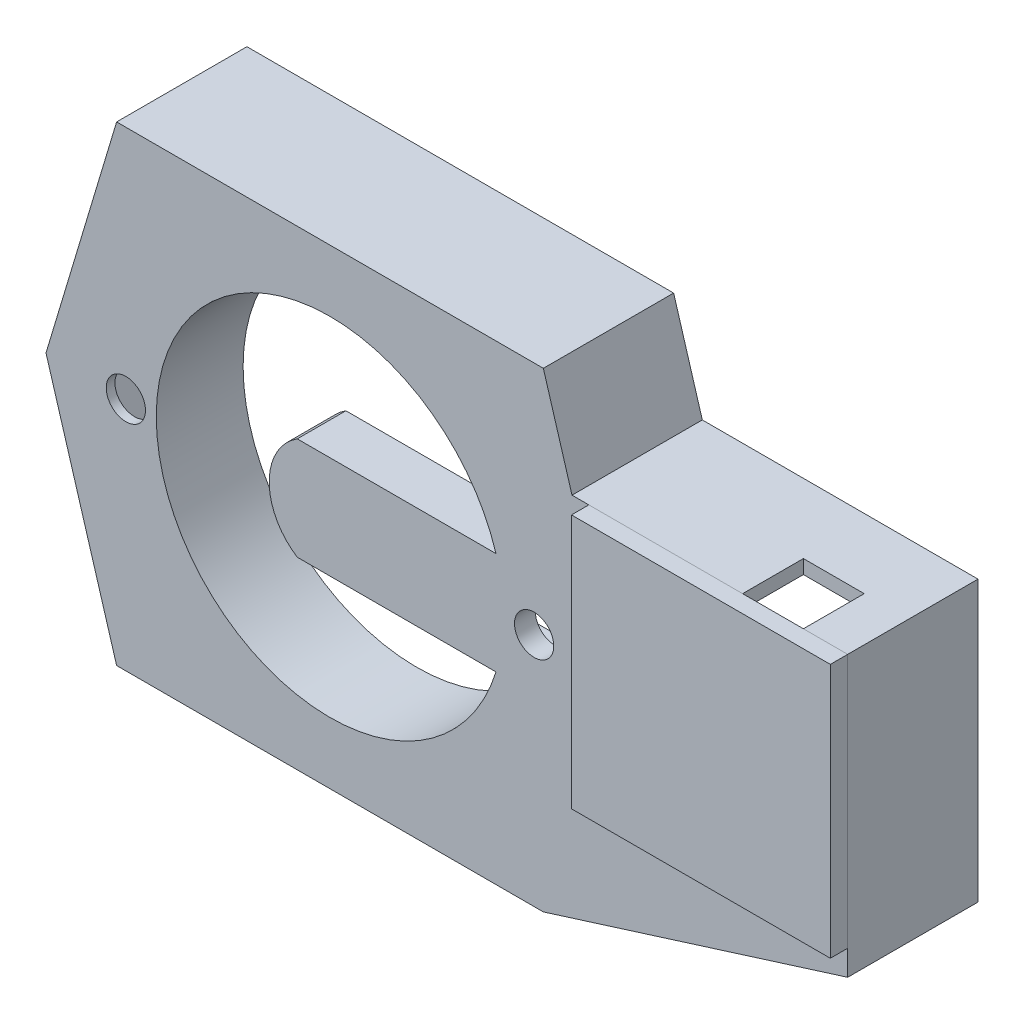
from build123d import *

# Parameters (mm, degrees)
BOSS_EXTRUDE1_DEPTH      = 10
BOSS_EXTRUDE1_DEPTH_BACK = 5
BOSS_EXTRUDE2_DEPTH      = 15
CUT_EXTRUDE1_DEPTH       = 68.168221653
BOSS_EXTRUDE3_DEPTH      = 4
SKETCH7_R                = 1.75
BOSS_EXTRUDE4_DEPTH      = 2.4
SKETCH8_R                = 3.5
BOSS_EXTRUDE5_DEPTH      = 1
CUT_EXTRUDE2_DEPTH       = 10
BOSS_EXTRUDE7_START      = 14
BOSS_EXTRUDE7_DEPTH      = 14
RIB9_START               = -9
RIB9_DEPTH               = 9
CUT_EXTRUDE3_DEPTH       = 5
SKETCH18_R               = 2.259673145
CUT_EXTRUDE4_DEPTH       = 68.168221653
SKETCH20_R               = 3.5
SKETCH20_W               = 8.6
SKETCH20_H               = 8.6
BOSS_EXTRUDE8_DEPTH      = 1
SKETCH21_W               = 7
SKETCH21_H               = 1.6
CUT_EXTRUDE5_DEPTH       = 7
BOSS_EXTRUDE9_DEPTH      = 1
BOSS_EXTRUDE10_DEPTH     = 14
BOSS_EXTRUDE11_DEPTH     = 2
SKETCH25_W               = 26.6
SKETCH25_H               = 26.1
BOSS_EXTRUDE12_DEPTH     = 1
BOSS_EXTRUDE13_DEPTH     = 4
CUT_EXTRUDE6_START       = -4
CUT_EXTRUDE6_DEPTH       = 4
BOSS_EXTRUDE14_DEPTH     = 1.6


# Read off the part's stored shape, not the designer's step: Rib9
with BuildPart() as part:
    # Sketch2 → Boss-Extrude1 (new, two sides: drawn at the far end of the back side and taken through both)
    with BuildSketch(Plane.XY.offset(12).offset(-BOSS_EXTRUDE1_DEPTH_BACK)):
        Polygon((-24.562464367, 27.1), (-32.692464367, 0), (-24.562464367, -27.1), (24.562464367, -27.1), (32.692464367, 0), (24.562464367, 27.1), align=None)
        Polygon((-23.372015325, 25.5), (-31.022015325, 0), (-23.372015325, -25.5), (23.372015325, -25.5), (31.022015325, 0), (23.372015325, 25.5), align=None, mode=Mode.SUBTRACT)
    extrude(amount=BOSS_EXTRUDE1_DEPTH + BOSS_EXTRUDE1_DEPTH_BACK)

    # Sketch3 → Boss-Extrude2 (add)
    with BuildSketch(Plane.XY.offset(22)):
        Polygon((29.5, 16.1), (59.6, 16.1), (59.6, -16.1), (29.5, -16.1), (27.862464367, -16.1), (28.342464367, -14.5), (29.5, -14.5), (58, -14.5), (58, 14.5), (29.5, 14.5), (28.342464367, 14.5), (27.862464367, 16.1), align=None)
    extrude(amount=-BOSS_EXTRUDE2_DEPTH)

    # Sketch4 → Cut-Extrude1 (cut, through all)
    with BuildSketch(Plane(origin=(0, 0, 7), x_dir=(-1, 0, 0), z_dir=(0, 0, -1))):
        Polygon((-26.672015325, 14.5), (-28.342464367, 14.5), (-32.692464367, 0), (-28.342464367, -14.5), (-26.672015325, -14.5), (-31.022015325, 0), align=None)
    extrude(amount=-CUT_EXTRUDE1_DEPTH, mode=Mode.SUBTRACT)

    # Sketch5 → Boss-Extrude3 (add)
    with BuildSketch(Plane.XY.offset(22)):
        Polygon((29, 4.3), (29, 14), (29, 14.5), (27.4, 14.5), (27.4, 14), (27.4, 5.9), (-4.6, 5.9), (-4.6, -5.9), (27.4, -5.9), (27.4, -14), (27.4, -14.5), (29, -14.5), (29, -14), (29, -4.3), (-3, -4.3), (-3, 4.3), align=None)
    extrude(amount=-BOSS_EXTRUDE3_DEPTH)

    # Sketch7 → Boss-Extrude4 (add)
    with BuildSketch(Plane.XY.offset(22)):
        Polygon((37, 12.1), (37, 14.5), (29, 14.5), (29, 4.3), (5.6, 4.3), (5.6, -4.3), (29, -4.3), (29, -14.5), (58, -14.5), (58, -11.6), (31.4, -11.6), (31.4, 12.1), align=None)
        with Locations((23.5, 0)):
            Circle(SKETCH7_R, mode=Mode.SUBTRACT)
    extrude(amount=-BOSS_EXTRUDE4_DEPTH)

    # Sketch8 → Boss-Extrude5 (add)
    with BuildSketch(Plane.XY.offset(22)):
        Polygon((27.4, -5.9), (27.4, -14.5), (26.672015325, -14.5), (23.372015325, -25.5), (-23.372015325, -25.5), (-31.022015325, 0), (-23.372015325, 25.5), (23.372015325, 25.5), (26.672015325, 14.5), (27.4, 14.5), (27.4, 5.9), (-4.6, 5.9), (-4.6, -5.9), align=None)
        with Locations((-18.25, 18.25)):
            Circle(SKETCH8_R, mode=Mode.SUBTRACT)
        with Locations((18.25, 18.25)):
            Circle(SKETCH8_R, mode=Mode.SUBTRACT)
        with Locations((18.25, -18.25)):
            Circle(SKETCH8_R, mode=Mode.SUBTRACT)
        with Locations((-18.25, -18.25)):
            Circle(SKETCH8_R, mode=Mode.SUBTRACT)
    extrude(amount=-BOSS_EXTRUDE5_DEPTH)

    # Sketch11 → Cut-Extrude2 (cut)
    with BuildSketch(Plane(origin=(0, 0, 21), x_dir=(-1, 0, 0), z_dir=(0, 0, -1))):
        with BuildLine():
            Line((4.6, -5.9), (-19.109945055, -5.9))
            ThreePointArc((-19.109945055, -5.9), (2.983378865, -19.776234489), (20, 0))
            ThreePointArc((20, 0), (2.983378865, 19.776234489), (-19.109945055, 5.9))
            Line((-19.109945055, 5.9), (4.6, 5.9))
            Line((4.6, 5.9), (4.6, -5.9))
        make_face()
    extrude(amount=-CUT_EXTRUDE2_DEPTH, mode=Mode.SUBTRACT)

    # Sketch12 → Boss-Extrude7 (add)
    with BuildSketch(Plane(origin=(0, 0, 21), x_dir=(-1, 0, 0), z_dir=(0, 0, -1)).offset(BOSS_EXTRUDE7_START)):
        with BuildLine():
            ThreePointArc((21.6, 0), (2.978452055, 21.393663159), (-20.778594755, 5.9))
            Line((-20.778594755, 5.9), (-19.109945055, 5.9))
            ThreePointArc((-19.109945055, 5.9), (20, 0), (-19.109945055, -5.9))
            Line((-19.109945055, -5.9), (-20.778594755, -5.9))
            ThreePointArc((-20.778594755, -5.9), (2.978452055, -21.393663159), (21.6, 0))
        make_face()
    extrude(amount=-BOSS_EXTRUDE7_DEPTH)

    # Rib9 outline → Rib9 (add)
    with BuildSketch(Plane(origin=(0, 0, 12), x_dir=(-1, 0, 0), z_dir=(0, 0, -1)).offset(RIB9_START)):
        with BuildLine():
            ThreePointArc((-0.8, 21.585180101), (0, 21.6), (0.8, 21.585180101))
            Line((0.8, 21.585180101), (0.8, 25.5))
            Line((0.8, 25.5), (-0.8, 25.5))
            Line((-0.8, 25.5), (-0.8, 21.585180101))
        make_face()
        with BuildLine():
            Line((26.205893326, 16.053739997), (18.293314313, 11.485410374))
            ThreePointArc((18.293314313, 11.485410374), (18.706148722, 10.8), (19.093314313, 10.099769728))
            Line((19.093314313, 10.099769728), (26.678322459, 14.478976222))
            Line((26.678322459, 14.478976222), (26.205893326, 16.053739997))
        make_face()
        with BuildLine():
            ThreePointArc((-19.093314313, 10.099769728), (-18.706148721, 10.8), (-18.293314313, 11.485410374))
            Line((-18.293314313, 11.485410374), (-26.205893326, 16.053739997))
            Line((-26.205893326, 16.053739997), (-26.672015325, 14.5))
            Line((-26.672015325, 14.5), (-26.71473671, 14.5))
            Line((-26.71473671, 14.5), (-19.093314313, 10.099769728))
        make_face()
        with BuildLine():
            Line((26.593085869, -14.763098188), (18.9565691, -10.354153175))
            ThreePointArc((18.9565691, -10.354153175), (18.560039094, -11.049205801), (18.138036207, -11.729093851))
            Line((18.138036207, -11.729093851), (26.120656737, -16.337861962))
            Line((26.120656737, -16.337861962), (26.593085869, -14.763098188))
        make_face()
        with BuildLine():
            Line((0.8, -25.5), (0.8, -21.585180101))
            ThreePointArc((0.8, -21.585180101), (0, -21.6), (-0.8, -21.585180101))
            Line((-0.8, -21.585180101), (-0.8, -25.5))
            Line((-0.8, -25.5), (0.8, -25.5))
        make_face()
        with BuildLine():
            Line((-26.291129916, -15.769618032), (-18.445244234, -11.239793821))
            ThreePointArc((-18.445244234, -11.239793821), (-18.848912462, -10.548862451), (-19.226711341, -9.843453205))
            Line((-19.226711341, -9.843453205), (-27.292086979, -14.5))
            Line((-27.292086979, -14.5), (-26.672015325, -14.5))
            Line((-26.672015325, -14.5), (-26.291129916, -15.769618032))
        make_face()
    extrude(amount=RIB9_DEPTH)

    # Sketch17 → Cut-Extrude3 (cut)
    with BuildSketch(Plane(origin=(0, 0, 7), x_dir=(-1, 0, 0), z_dir=(0, 0, -1))):
        with BuildLine():
            Line((-19.109945055, -5.9), (-20.778594755, -5.9))
            ThreePointArc((-20.778594755, -5.9), (21.6, 0), (-20.778594755, 5.9))
            Line((-20.778594755, 5.9), (-19.109945055, 5.9))
            ThreePointArc((-19.109945055, 5.9), (20, 0), (-19.109945055, -5.9))
        make_face()
    extrude(amount=-CUT_EXTRUDE3_DEPTH, mode=Mode.SUBTRACT)

    # Sketch18 → Cut-Extrude4 (cut, through all)
    with BuildSketch(Plane.XY.offset(22)):
        with Locations((-23.5, 0)):
            Circle(SKETCH18_R)
        with Locations((23.5, 0)):
            Circle(SKETCH18_R)
    extrude(amount=-CUT_EXTRUDE4_DEPTH, mode=Mode.SUBTRACT)

    # Sketch20 → Boss-Extrude8 (add)
    with BuildSketch(Plane.XY.offset(22)):
        with Locations((18.25, 18.25)):
            Circle(SKETCH20_R)
        with Locations((18.25, -18.25)):
            Circle(SKETCH20_R)
        with Locations((-18.25, -18.25)):
            Circle(SKETCH20_R)
        with Locations((-18.25, 18.25)):
            Circle(SKETCH20_R)
        with Locations((1.3, 0)):
            Rectangle(SKETCH20_W, SKETCH20_H)
    extrude(amount=-BOSS_EXTRUDE8_DEPTH)

    # Sketch21 → Cut-Extrude5 (cut)
    with BuildSketch(Plane.XY.offset(22)):
        with Locations((51, 15.3)):
            Rectangle(SKETCH21_W, SKETCH21_H)
    extrude(amount=-CUT_EXTRUDE5_DEPTH, mode=Mode.SUBTRACT)

    # Sketch22 → Boss-Extrude9 (add)
    with BuildSketch(Plane.XY.offset(22)):
        Polygon((24.562464367, -27.1), (59.6, -16.1), (27.862464367, -16.1), align=None)
    extrude(amount=-BOSS_EXTRUDE9_DEPTH)

    # Sketch23 → Boss-Extrude10 (add)
    with BuildSketch(Plane(origin=(0, 0, 21), x_dir=(-1, 0, 0), z_dir=(0, 0, -1))):
        Polygon((-25.117875099, -25.248630892), (-54.258373362, -16.1), (-59.6, -16.1), (-24.562464367, -27.1), align=None)
    extrude(amount=BOSS_EXTRUDE10_DEPTH)

    # Sketch26 → Boss-Extrude13 (add)
    with BuildSketch(Plane.XY.offset(22)):
        with BuildLine():
            ThreePointArc((-7, 0), (-6.371812929, -2.898275349), (-4.6, -5.276362383))
            Line((-4.6, -5.276362383), (-4.6, 0))
            Line((-4.6, 0), (-7, 0))
        make_face()
        with BuildLine():
            Line((-7, 0), (-4.6, 0))
            Line((-4.6, 0), (-4.6, 5.276362383))
            ThreePointArc((-4.6, 5.276362383), (-6.371812929, 2.898275349), (-7, 0))
        make_face()
    extrude(amount=-BOSS_EXTRUDE13_DEPTH)

    # Sketch28 → Cut-Extrude6 (cut)
    with BuildSketch(Plane(origin=(0, 0, 18), x_dir=(-1, 0, 0), z_dir=(0, 0, -1)).offset(CUT_EXTRUDE6_START)):
        with BuildLine():
            ThreePointArc((3.76696164, 5.9), (4.195085546, 5.603682473), (4.6, 5.276362383))
            Line((4.6, 5.276362383), (4.6, 5.9))
            Line((4.6, 5.9), (3.76696164, 5.9))
        make_face()
        with BuildLine():
            Line((3.76696164, -5.9), (4.6, -5.9))
            Line((4.6, -5.9), (4.6, -5.276362383))
            ThreePointArc((4.6, -5.276362383), (4.195085546, -5.603682473), (3.76696164, -5.9))
        make_face()
    extrude(amount=CUT_EXTRUDE6_DEPTH, mode=Mode.SUBTRACT)

    # Sketch29 → Boss-Extrude14 (add)
    with BuildSketch(Plane(origin=(0, 0, 18), x_dir=(-1, 0, 0), z_dir=(0, 0, -1))):
        with BuildLine():
            Line((3.76696164, 5.9), (-19.109945055, 5.9))
            Line((-19.109945055, 5.9), (-20.778594755, 5.9))
            Line((-20.778594755, 5.9), (-27.4, 5.9))
            Line((-27.4, 5.9), (-27.4, 14.5))
            Line((-27.4, 14.5), (-29, 14.5))
            Line((-29, 14.5), (-29, 4.3))
            Line((-29, 4.3), (3, 4.3))
            Line((3, 4.3), (3, -4.3))
            Line((3, -4.3), (-29, -4.3))
            Line((-29, -4.3), (-29, -14.5))
            Line((-29, -14.5), (-27.4, -14.5))
            Line((-27.4, -14.5), (-27.4, -5.9))
            Line((-27.4, -5.9), (-20.778594755, -5.9))
            Line((-20.778594755, -5.9), (-19.109945055, -5.9))
            Line((-19.109945055, -5.9), (3.76696164, -5.9))
            ThreePointArc((3.76696164, -5.9), (7, 0), (3.76696164, 5.9))
        make_face()
    extrude(amount=BOSS_EXTRUDE14_DEPTH)


with BuildPart() as body_2:
    # Sketch24 → Boss-Extrude11 (new body)
    with BuildSketch(Plane.XY.offset(22)):
        Polygon((59.6, 16.1), (29.8, 16.1), (29.8, 12.1), (29.8, -13.2), (59.6, -13.2), align=None)
        Polygon((58, 14.5), (58, -11.6), (31.4, -11.6), (31.4, 12.1), (31.4, 14.5), align=None, mode=Mode.SUBTRACT)
    extrude(amount=BOSS_EXTRUDE11_DEPTH)

    # Sketch25 → Boss-Extrude12 (add)
    with BuildSketch(Plane.XY.offset(24)):
        with Locations((44.7, 1.45)):
            Rectangle(SKETCH25_W, SKETCH25_H)
    extrude(amount=-BOSS_EXTRUDE12_DEPTH)


solid = Compound([part.part, body_2.part])
